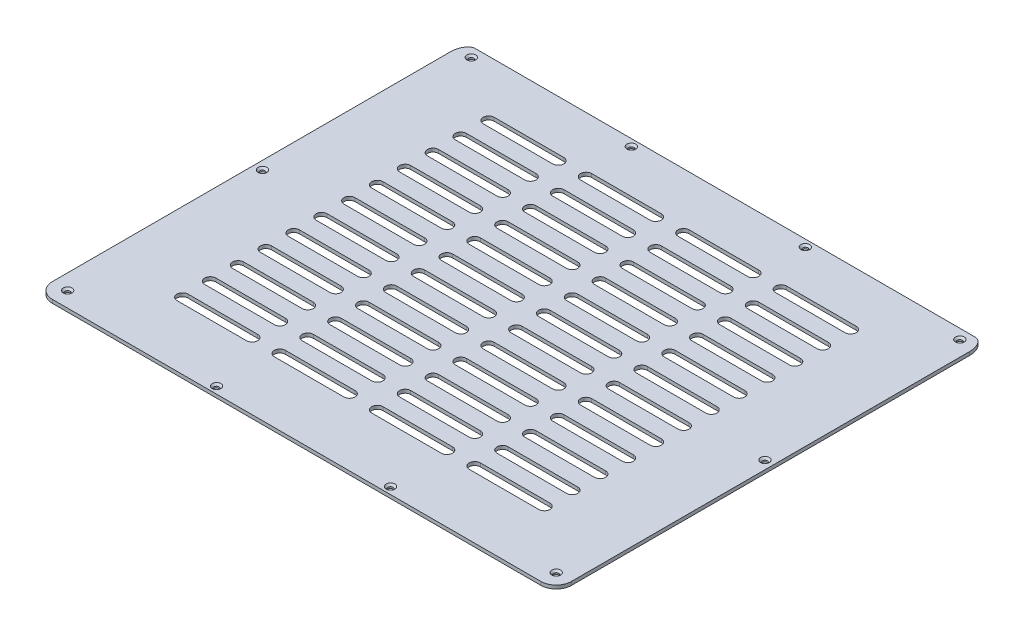
from build123d import *

# Parameters (mm, degrees)
SKETCH_1_W                   = 373
SKETCH_1_H                   = 308
EXTRUDE_1_DEPTH              = 2.5
FILLET_1_R                   = 11
FILLET_2_SIZE                = 11
FILLET_2_SIZE_2              = 7
FILLET_3_SIZE                = 7
FILLET_3_SIZE_2              = 11
HOLE_WIZARD_M3_1_AT_2_COUNT  = 2
HOLE_WIZARD_M3_1_AT_2_PITCH  = 113.017697729
HOLE_WIZARD_M3_1_AT_3_COUNT  = 2
HOLE_WIZARD_M3_1_AT_3_PITCH  = 238.008403213
HOLE_WIZARD_M3_1_AT_4_COUNT  = 2
HOLE_WIZARD_M3_1_AT_4_PITCH  = 351
HOLE_WIZARD_M3_1_AT_5_COUNT  = 2
HOLE_WIZARD_M3_1_AT_5_PITCH  = 384.396930269
HOLE_WIZARD_M3_1_AT_6_COUNT  = 2
HOLE_WIZARD_M3_1_AT_6_PITCH  = 455.303195684
HOLE_WIZARD_M3_1_AT_7_COUNT  = 2
HOLE_WIZARD_M3_1_AT_7_PITCH  = 379.815744803
HOLE_WIZARD_M3_1_AT_8_COUNT  = 2
HOLE_WIZARD_M3_1_AT_8_PITCH  = 316.835919681
HOLE_WIZARD_M3_1_AT_9_COUNT  = 2
HOLE_WIZARD_M3_1_AT_9_PITCH  = 290
HOLE_WIZARD_M3_1_AT_10_COUNT = 2
HOLE_WIZARD_M3_1_AT_10_PITCH = 145.086181285
CUT_EXTRUDE_1_DEPTH          = 2.5


with BuildPart() as part:
    # 草圖1 → 填料-伸長1 (new body)
    with BuildSketch(Plane(origin=(0, 0, 0), x_dir=(1, 0, 0), z_dir=(0, 1, 0))):
        Rectangle(SKETCH_1_W, SKETCH_1_H)
    extrude(amount=EXTRUDE_1_DEPTH)

    # 圓角1
    fillet_1_edges = [part.edges().sort_by_distance(p)[0] for p in [
        (186.5, 1.25, 154),
        (-186.5, 1.25, 154),
    ]]
    fillet(fillet_1_edges, radius=FILLET_1_R)

    # 圓角2
    # an asymmetric fillet: 11, 7 mm, written as the material it takes off along each edge
    with BuildSketch(Plane(origin=(-186.5, -27.5, -154), x_dir=(0, 0, 1), z_dir=(0, 1, 0))) as fillet_2_piece_1:
        with BuildLine():
            Bezier((FILLET_2_SIZE, 0), (0, 0), (0, FILLET_2_SIZE_2), weights=[1, 0.707106781, 1])
            Line((0, FILLET_2_SIZE_2), (0, 0))
            Line((0, 0), (FILLET_2_SIZE, 0))
        make_face()
    extrude(amount=57.5, mode=Mode.SUBTRACT)

    # 圓角3
    # an asymmetric fillet: 11, 7 mm, written as the material it takes off along each edge
    with BuildSketch(Plane(origin=(186.5, -27.5, -154), x_dir=(-1, 0, 0), z_dir=(0, 1, 0))) as fillet_3_piece_1:
        with BuildLine():
            Bezier((FILLET_3_SIZE, 0), (0, 0), (0, FILLET_3_SIZE_2), weights=[1, 0.707106781, 1])
            Line((0, FILLET_3_SIZE_2), (0, 0))
            Line((0, 0), (FILLET_3_SIZE, 0))
        make_face()
    extrude(amount=57.5, mode=Mode.SUBTRACT)

    # 草圖3 → M3 錐坑平頭螺釘的錐孔1 (revolve, cut)
    with BuildSketch(Plane(origin=(-175.5, 2.5, -147), x_dir=(0, 0, 1), z_dir=(1, 0, 0))):
        Polygon((0, 0), (0, 2.555), (1.8, 2.555), (1.8, 1.35), (3.15, 0), align=None)
    hole_wizard_m3_1 = revolve(axis=Axis((-175.5, 8.85, -147), (0, -1, 0)), mode=Mode.SUBTRACT)

    # M3 錐坑平頭螺釘的錐孔1 at 2: M3 錐坑平頭螺釘的錐孔1 ×2
    with Locations(*[Vector(0.9998434074528452, 0, -0.017696343494740616) * (i * HOLE_WIZARD_M3_1_AT_2_PITCH) for i in range(1, HOLE_WIZARD_M3_1_AT_2_COUNT)]):
        add(hole_wizard_m3_1, mode=Mode.SUBTRACT)

    # M3 錐坑平頭螺釘的錐孔1 at 3: M3 錐坑平頭螺釘的錐孔1 ×2
    with Locations(*[Vector(0.9999646936289543, 0, -0.008403064652344154) * (i * HOLE_WIZARD_M3_1_AT_3_PITCH) for i in range(1, HOLE_WIZARD_M3_1_AT_3_COUNT)]):
        add(hole_wizard_m3_1, mode=Mode.SUBTRACT)

    # M3 錐坑平頭螺釘的錐孔1 at 4: M3 錐坑平頭螺釘的錐孔1 ×2
    with Locations(*[(i * HOLE_WIZARD_M3_1_AT_4_PITCH, 0, 0) for i in range(1, HOLE_WIZARD_M3_1_AT_4_COUNT)]):
        add(hole_wizard_m3_1, mode=Mode.SUBTRACT)

    # M3 錐坑平頭螺釘的錐孔1 at 5: M3 錐坑平頭螺釘的錐孔1 ×2
    with Locations(*[Vector(0.9261260222633665, 0, 0.37721425064097797) * (i * HOLE_WIZARD_M3_1_AT_5_PITCH) for i in range(1, HOLE_WIZARD_M3_1_AT_5_COUNT)]):
        add(hole_wizard_m3_1, mode=Mode.SUBTRACT)

    # M3 錐坑平頭螺釘的錐孔1 at 6: M3 錐坑平頭螺釘的錐孔1 ×2
    with Locations(*[Vector(0.7709148614095436, 0, 0.6369382045833836) * (i * HOLE_WIZARD_M3_1_AT_6_PITCH) for i in range(1, HOLE_WIZARD_M3_1_AT_6_COUNT)]):
        add(hole_wizard_m3_1, mode=Mode.SUBTRACT)

    # M3 錐坑平頭螺釘的錐孔1 at 7: M3 錐坑平頭螺釘的錐孔1 ×2
    with Locations(*[Vector(0.6266196261128053, 0, 0.7793252492831527) * (i * HOLE_WIZARD_M3_1_AT_7_PITCH) for i in range(1, HOLE_WIZARD_M3_1_AT_7_COUNT)]):
        add(hole_wizard_m3_1, mode=Mode.SUBTRACT)

    # M3 錐坑平頭螺釘的錐孔1 at 8: M3 錐坑平頭螺釘的錐孔1 ×2
    with Locations(*[Vector(0.3566514810373489, 0, 0.9342375078500464) * (i * HOLE_WIZARD_M3_1_AT_8_PITCH) for i in range(1, HOLE_WIZARD_M3_1_AT_8_COUNT)]):
        add(hole_wizard_m3_1, mode=Mode.SUBTRACT)

    # M3 錐坑平頭螺釘的錐孔1 at 9: M3 錐坑平頭螺釘的錐孔1 ×2
    with Locations(*[(0, 0, i * HOLE_WIZARD_M3_1_AT_9_PITCH) for i in range(1, HOLE_WIZARD_M3_1_AT_9_COUNT)]):
        add(hole_wizard_m3_1, mode=Mode.SUBTRACT)

    # M3 錐坑平頭螺釘的錐孔1 at 10: M3 錐坑平頭螺釘的錐孔1 ×2
    with Locations(*[Vector(-0.03446227583977888, 0, 0.9994059993535875) * (i * HOLE_WIZARD_M3_1_AT_10_PITCH) for i in range(1, HOLE_WIZARD_M3_1_AT_10_COUNT)]):
        add(hole_wizard_m3_1, mode=Mode.SUBTRACT)

    # 草圖4 → 除料-伸長1 (cut)
    with BuildSketch(Plane(origin=(0, 2.5, 0), x_dir=(1, 0, 0), z_dir=(0, 1, 0))):
        with BuildLine():
            Line((-130, 118), (-80, 118))
            ThreePointArc((-80, 118), (-76, 114), (-80, 110))
            Line((-80, 110), (-130, 110))
            ThreePointArc((-130, 110), (-134, 114), (-130, 118))
        make_face()
        with BuildLine():
            Line((-60, 118), (-10, 118))
            ThreePointArc((-10, 118), (-6, 114), (-10, 110))
            Line((-10, 110), (-60, 110))
            ThreePointArc((-60, 110), (-64, 114), (-60, 118))
        make_face()
        with BuildLine():
            Line((10, 118), (60, 118))
            ThreePointArc((60, 118), (64, 114), (60, 110))
            Line((60, 110), (10, 110))
            ThreePointArc((10, 110), (6, 114), (10, 118))
        make_face()
        with BuildLine():
            Line((80, 118), (130, 118))
            ThreePointArc((130, 118), (134, 114), (130, 110))
            Line((130, 110), (80, 110))
            ThreePointArc((80, 110), (76, 114), (80, 118))
        make_face()
        with BuildLine():
            Line((-60, 98), (-10, 98))
            ThreePointArc((-10, 98), (-6, 94), (-10, 90))
            Line((-10, 90), (-60, 90))
            ThreePointArc((-60, 90), (-64, 94), (-60, 98))
        make_face()
        with BuildLine():
            Line((10, 98), (60, 98))
            ThreePointArc((60, 98), (64, 94), (60, 90))
            Line((60, 90), (10, 90))
            ThreePointArc((10, 90), (6, 94), (10, 98))
        make_face()
        with BuildLine():
            Line((80, 98), (130, 98))
            ThreePointArc((130, 98), (134, 94), (130, 90))
            Line((130, 90), (80, 90))
            ThreePointArc((80, 90), (76, 94), (80, 98))
        make_face()
        with BuildLine():
            Line((-60, 78), (-10, 78))
            ThreePointArc((-10, 78), (-6, 74), (-10, 70))
            Line((-10, 70), (-60, 70))
            ThreePointArc((-60, 70), (-64, 74), (-60, 78))
        make_face()
        with BuildLine():
            Line((10, 78), (60, 78))
            ThreePointArc((60, 78), (64, 74), (60, 70))
            Line((60, 70), (10, 70))
            ThreePointArc((10, 70), (6, 74), (10, 78))
        make_face()
        with BuildLine():
            Line((80, 78), (130, 78))
            ThreePointArc((130, 78), (134, 74), (130, 70))
            Line((130, 70), (80, 70))
            ThreePointArc((80, 70), (76, 74), (80, 78))
        make_face()
        with BuildLine():
            Line((-60, 58), (-10, 58))
            ThreePointArc((-10, 58), (-6, 54), (-10, 50))
            Line((-10, 50), (-60, 50))
            ThreePointArc((-60, 50), (-64, 54), (-60, 58))
        make_face()
        with BuildLine():
            Line((10, 58), (60, 58))
            ThreePointArc((60, 58), (64, 54), (60, 50))
            Line((60, 50), (10, 50))
            ThreePointArc((10, 50), (6, 54), (10, 58))
        make_face()
        with BuildLine():
            Line((80, 58), (130, 58))
            ThreePointArc((130, 58), (134, 54), (130, 50))
            Line((130, 50), (80, 50))
            ThreePointArc((80, 50), (76, 54), (80, 58))
        make_face()
        with BuildLine():
            Line((-60, 38), (-10, 38))
            ThreePointArc((-10, 38), (-6, 34), (-10, 30))
            Line((-10, 30), (-60, 30))
            ThreePointArc((-60, 30), (-64, 34), (-60, 38))
        make_face()
        with BuildLine():
            Line((10, 38), (60, 38))
            ThreePointArc((60, 38), (64, 34), (60, 30))
            Line((60, 30), (10, 30))
            ThreePointArc((10, 30), (6, 34), (10, 38))
        make_face()
        with BuildLine():
            Line((80, 38), (130, 38))
            ThreePointArc((130, 38), (134, 34), (130, 30))
            Line((130, 30), (80, 30))
            ThreePointArc((80, 30), (76, 34), (80, 38))
        make_face()
        with BuildLine():
            Line((-60, 18), (-10, 18))
            ThreePointArc((-10, 18), (-6, 14), (-10, 10))
            Line((-10, 10), (-60, 10))
            ThreePointArc((-60, 10), (-64, 14), (-60, 18))
        make_face()
        with BuildLine():
            Line((10, 18), (60, 18))
            ThreePointArc((60, 18), (64, 14), (60, 10))
            Line((60, 10), (10, 10))
            ThreePointArc((10, 10), (6, 14), (10, 18))
        make_face()
        with BuildLine():
            Line((80, 18), (130, 18))
            ThreePointArc((130, 18), (134, 14), (130, 10))
            Line((130, 10), (80, 10))
            ThreePointArc((80, 10), (76, 14), (80, 18))
        make_face()
        with BuildLine():
            Line((-60, -2), (-10, -2))
            ThreePointArc((-10, -2), (-6, -6), (-10, -10))
            Line((-10, -10), (-60, -10))
            ThreePointArc((-60, -10), (-64, -6), (-60, -2))
        make_face()
        with BuildLine():
            Line((10, -2), (60, -2))
            ThreePointArc((60, -2), (64, -6), (60, -10))
            Line((60, -10), (10, -10))
            ThreePointArc((10, -10), (6, -6), (10, -2))
        make_face()
        with BuildLine():
            Line((80, -2), (130, -2))
            ThreePointArc((130, -2), (134, -6), (130, -10))
            Line((130, -10), (80, -10))
            ThreePointArc((80, -10), (76, -6), (80, -2))
        make_face()
        with BuildLine():
            Line((-60, -22), (-10, -22))
            ThreePointArc((-10, -22), (-6, -26), (-10, -30))
            Line((-10, -30), (-60, -30))
            ThreePointArc((-60, -30), (-64, -26), (-60, -22))
        make_face()
        with BuildLine():
            Line((10, -22), (60, -22))
            ThreePointArc((60, -22), (64, -26), (60, -30))
            Line((60, -30), (10, -30))
            ThreePointArc((10, -30), (6, -26), (10, -22))
        make_face()
        with BuildLine():
            Line((80, -22), (130, -22))
            ThreePointArc((130, -22), (134, -26), (130, -30))
            Line((130, -30), (80, -30))
            ThreePointArc((80, -30), (76, -26), (80, -22))
        make_face()
        with BuildLine():
            Line((-60, -42), (-10, -42))
            ThreePointArc((-10, -42), (-6, -46), (-10, -50))
            Line((-10, -50), (-60, -50))
            ThreePointArc((-60, -50), (-64, -46), (-60, -42))
        make_face()
        with BuildLine():
            Line((10, -42), (60, -42))
            ThreePointArc((60, -42), (64, -46), (60, -50))
            Line((60, -50), (10, -50))
            ThreePointArc((10, -50), (6, -46), (10, -42))
        make_face()
        with BuildLine():
            Line((80, -42), (130, -42))
            ThreePointArc((130, -42), (134, -46), (130, -50))
            Line((130, -50), (80, -50))
            ThreePointArc((80, -50), (76, -46), (80, -42))
        make_face()
        with BuildLine():
            Line((-60, -62), (-10, -62))
            ThreePointArc((-10, -62), (-6, -66), (-10, -70))
            Line((-10, -70), (-60, -70))
            ThreePointArc((-60, -70), (-64, -66), (-60, -62))
        make_face()
        with BuildLine():
            Line((10, -62), (60, -62))
            ThreePointArc((60, -62), (64, -66), (60, -70))
            Line((60, -70), (10, -70))
            ThreePointArc((10, -70), (6, -66), (10, -62))
        make_face()
        with BuildLine():
            Line((80, -62), (130, -62))
            ThreePointArc((130, -62), (134, -66), (130, -70))
            Line((130, -70), (80, -70))
            ThreePointArc((80, -70), (76, -66), (80, -62))
        make_face()
        with BuildLine():
            Line((-60, -82), (-10, -82))
            ThreePointArc((-10, -82), (-6, -86), (-10, -90))
            Line((-10, -90), (-60, -90))
            ThreePointArc((-60, -90), (-64, -86), (-60, -82))
        make_face()
        with BuildLine():
            Line((10, -82), (60, -82))
            ThreePointArc((60, -82), (64, -86), (60, -90))
            Line((60, -90), (10, -90))
            ThreePointArc((10, -90), (6, -86), (10, -82))
        make_face()
        with BuildLine():
            Line((80, -82), (130, -82))
            ThreePointArc((130, -82), (134, -86), (130, -90))
            Line((130, -90), (80, -90))
            ThreePointArc((80, -90), (76, -86), (80, -82))
        make_face()
        with BuildLine():
            Line((-60, -102), (-10, -102))
            ThreePointArc((-10, -102), (-6, -106), (-10, -110))
            Line((-10, -110), (-60, -110))
            ThreePointArc((-60, -110), (-64, -106), (-60, -102))
        make_face()
        with BuildLine():
            Line((10, -102), (60, -102))
            ThreePointArc((60, -102), (64, -106), (60, -110))
            Line((60, -110), (10, -110))
            ThreePointArc((10, -110), (6, -106), (10, -102))
        make_face()
        with BuildLine():
            Line((80, -102), (130, -102))
            ThreePointArc((130, -102), (134, -106), (130, -110))
            Line((130, -110), (80, -110))
            ThreePointArc((80, -110), (76, -106), (80, -102))
        make_face()
        with BuildLine():
            Line((-130, 98), (-80, 98))
            ThreePointArc((-80, 98), (-76, 94), (-80, 90))
            Line((-80, 90), (-130, 90))
            ThreePointArc((-130, 90), (-134, 94), (-130, 98))
        make_face()
        with BuildLine():
            Line((-130, 78), (-80, 78))
            ThreePointArc((-80, 78), (-76, 74), (-80, 70))
            Line((-80, 70), (-130, 70))
            ThreePointArc((-130, 70), (-134, 74), (-130, 78))
        make_face()
        with BuildLine():
            Line((-130, 58), (-80, 58))
            ThreePointArc((-80, 58), (-76, 54), (-80, 50))
            Line((-80, 50), (-130, 50))
            ThreePointArc((-130, 50), (-134, 54), (-130, 58))
        make_face()
        with BuildLine():
            Line((-130, 38), (-80, 38))
            ThreePointArc((-80, 38), (-76, 34), (-80, 30))
            Line((-80, 30), (-130, 30))
            ThreePointArc((-130, 30), (-134, 34), (-130, 38))
        make_face()
        with BuildLine():
            Line((-130, 18), (-80, 18))
            ThreePointArc((-80, 18), (-76, 14), (-80, 10))
            Line((-80, 10), (-130, 10))
            ThreePointArc((-130, 10), (-134, 14), (-130, 18))
        make_face()
        with BuildLine():
            Line((-130, -2), (-80, -2))
            ThreePointArc((-80, -2), (-76, -6), (-80, -10))
            Line((-80, -10), (-130, -10))
            ThreePointArc((-130, -10), (-134, -6), (-130, -2))
        make_face()
        with BuildLine():
            Line((-130, -22), (-80, -22))
            ThreePointArc((-80, -22), (-76, -26), (-80, -30))
            Line((-80, -30), (-130, -30))
            ThreePointArc((-130, -30), (-134, -26), (-130, -22))
        make_face()
        with BuildLine():
            Line((-130, -42), (-80, -42))
            ThreePointArc((-80, -42), (-76, -46), (-80, -50))
            Line((-80, -50), (-130, -50))
            ThreePointArc((-130, -50), (-134, -46), (-130, -42))
        make_face()
        with BuildLine():
            Line((-130, -62), (-80, -62))
            ThreePointArc((-80, -62), (-76, -66), (-80, -70))
            Line((-80, -70), (-130, -70))
            ThreePointArc((-130, -70), (-134, -66), (-130, -62))
        make_face()
        with BuildLine():
            Line((-130, -82), (-80, -82))
            ThreePointArc((-80, -82), (-76, -86), (-80, -90))
            Line((-80, -90), (-130, -90))
            ThreePointArc((-130, -90), (-134, -86), (-130, -82))
        make_face()
        with BuildLine():
            Line((-130, -102), (-80, -102))
            ThreePointArc((-80, -102), (-76, -106), (-80, -110))
            Line((-80, -110), (-130, -110))
            ThreePointArc((-130, -110), (-134, -106), (-130, -102))
        make_face()
    extrude(amount=-CUT_EXTRUDE_1_DEPTH, mode=Mode.SUBTRACT)


solid = part.part
